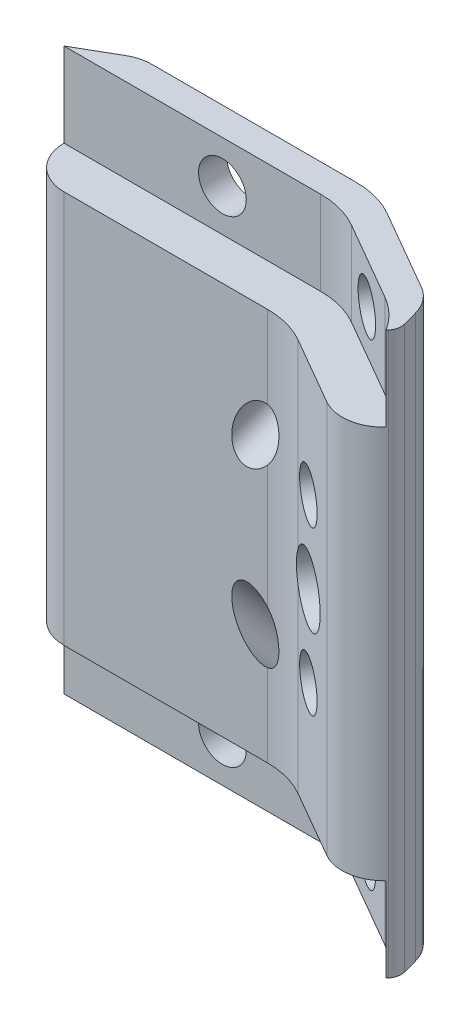
from build123d import *

# Parameters (mm, degrees)
AUFSATZ_LINEAR_AUSTRAGEN1_DEPTH  = 40
SCHNITT_LINEAR_AUSTRAGEN3_DEPTH  = 40
SCHNITT_LINEAR_START             = -6
SCHNITT_LINEAR_AUSTRAGEN4_DEPTH  = 6
SCHNITT_LINEAR_AUSTRAGEN5_DEPTH  = 6
VERRUNDUNG1_R                    = 3
SCHNITT_LINEAR_AUSTRAGEN6_REACH  = 45.817
SKIZZE5_R                        = 1.7
SCHNITT_LINEAR_AUSTRAGEN7_REACH  = 49.001
SKIZZE6_R                        = 1.7
SCHNITT_ROTATION_D_NN1_START     = 26.307192439
SCHNITT_ROTATION_D_NN1_OUTLINE_R = 1.5
SCHNITT_ROTATION_D_NN1_DEPTH     = 11.713572656
SCHNITT_ROTATION_D_NN2_START     = -1.977078808
SCHNITT_ROTATION_D_NN2_OUTLINE_R = 1.5
SCHNITT_ROTATION_D_NN2_DEPTH     = 11.713571611
VERRUNDUNG2_R                    = 1
SCHNITT_LINEAR_AUSTRAGEN8_DEPTH  = 2
SCHNITT_LINEAR_AUSTRAGEN9_REACH  = 45.817
SKIZZE10_R                       = 2.3
SKIZZE10_R_2                     = 1.7


# Read off the part's stored shape, not the designer's step: Schnitt-Rotation-Dünn1, Schnitt-Rotation-Dünn2
with BuildPart() as part:
    # Skizze1 → Aufsatz-Linear austragen1 (new body)
    with BuildSketch(Plane(origin=(0, 0, 0), x_dir=(1, 0, 0), z_dir=(0, 1, 0))):
        with BuildLine():
            Line((-5.759831503, 14.966295554), (13.068371728, 14.966295554))
            ThreePointArc((13.068371728, 14.966295554), (14.621285998, 14.761850511), (16.068371728, 14.162447976))
            Line((16.068371728, 14.162447976), (24.666447939, 9.198346361))
            Line((24.666447939, 9.198346361), (22.166447939, 4.868219342))
            Line((22.166447939, 4.868219342), (14.728625766, 9.162447976))
            ThreePointArc((14.728625766, 9.162447976), (13.281540036, 9.761850511), (11.728625766, 9.966295554))
            Line((11.728625766, 9.966295554), (-5.759831503, 9.966295554))
            Line((-5.759831503, 9.966295554), (-5.759831503, 14.966295554))
        make_face()
    extrude(amount=AUFSATZ_LINEAR_AUSTRAGEN1_DEPTH)

    # Skizze2 → Schnitt-Linear austragen3 (cut)
    with BuildSketch(Plane(origin=(0, 40, 0), x_dir=(1, 0, 0), z_dir=(0, 1, 0))):
        Polygon((-5.759831503, 14.966295554), (-5.759831503, 12.966295554), (-2.295729887, 14.966295554), align=None)
        Polygon((24.666447939, 9.198346361), (22.934397132, 10.198346361), (23.666447939, 7.466295554), align=None)
    extrude(amount=-SCHNITT_LINEAR_AUSTRAGEN3_DEPTH, mode=Mode.SUBTRACT)

    # Skizze3 → Schnitt-Linear austragen4 (cut)
    with BuildSketch(Plane(origin=(0, 40, 0), x_dir=(1, 0, 0), z_dir=(0, 1, 0)).offset(SCHNITT_LINEAR_START)):
        with BuildLine():
            Line((-5.759831503, 12.966295554), (12.532473343, 12.966295554))
            ThreePointArc((12.532473343, 12.966295554), (14.085387613, 12.761850511), (15.532473343, 12.162447976))
            Line((15.532473343, 12.162447976), (21.181781368, 8.900818467))
            ThreePointArc((21.181781368, 8.900818467), (23.993765179, 5.194915748), (23.31194468, 0.593167307))
            Line((23.31194468, 0.593167307), (22.166447939, 4.868219342))
            Line((22.166447939, 4.868219342), (14.728625766, 9.162447976))
            ThreePointArc((14.728625766, 9.162447976), (13.281540036, 9.761850511), (11.728625766, 9.966295554))
            Line((11.728625766, 9.966295554), (-5.759831503, 9.966295554))
            Line((-5.759831503, 9.966295554), (-5.759831503, 12.966295554))
        make_face()
    extrude(amount=SCHNITT_LINEAR_AUSTRAGEN4_DEPTH, mode=Mode.SUBTRACT)

    # Skizze4 → Schnitt-Linear austragen5 (cut)
    with BuildSketch(Plane.XZ):
        with BuildLine():
            Line((21.181781368, -8.900818467), (15.532473343, -12.162447976))
            ThreePointArc((15.532473343, -12.162447976), (14.085387614, -12.761850511), (12.532473343, -12.966295554))
            Line((12.532473343, -12.966295554), (-5.759831503, -12.966295554))
            Line((-5.759831503, -12.966295554), (-5.759831503, -9.966295554))
            Line((-5.759831503, -9.966295554), (11.728625766, -9.966295554))
            ThreePointArc((11.728625766, -9.966295554), (13.281540036, -9.761850511), (14.728625766, -9.162447976))
            Line((14.728625766, -9.162447976), (22.166447939, -4.868219342))
            Line((22.166447939, -4.868219342), (23.31194468, -0.593167307))
            ThreePointArc((23.31194468, -0.593167307), (23.993765179, -5.194915748), (21.181781368, -8.900818467))
        make_face()
    extrude(amount=-SCHNITT_LINEAR_AUSTRAGEN5_DEPTH, mode=Mode.SUBTRACT)

    # Verrundung1
    verrundung1_edges = [part.edges().sort_by_distance(p)[0] for p in [
        (22.934397132, 20, -10.198346361),
        (-2.295729887, 20, -14.966295554),
        (22.166447939, 20, -4.868219342),
        (-5.759831503, 20, -9.966295554),
    ]]
    fillet(verrundung1_edges, radius=VERRUNDUNG1_R - 0.0001)  # a hair under: the kernel refuses the full size

    # Skizze5 → Schnitt-Linear austragen6 (cut, up to next)
    with BuildSketch(Plane(origin=(9.149612796, 0, -15.847594231), x_dir=(0.8660254037844386, 0, 0.5000000000000003), z_dir=(-0.5000000000000002, 0, 0.8660254037844385)), mode=Mode.PRIVATE) as schnitt_linear_austragen6_sk1:
        with Locations((10.37029251, 3)):
            Circle(SKIZZE5_R)
    schnitt_linear_austragen6_tool1 = extrude(schnitt_linear_austragen6_sk1.sketch, amount=-SCHNITT_LINEAR_AUSTRAGEN6_REACH, mode=Mode.PRIVATE) & part.part
    # Skizze5 → Schnitt-Linear austragen6 (cut, up to next)
    with BuildSketch(Plane(origin=(9.149612796, 0, -15.847594231), x_dir=(0.8660254037844386, 0, 0.5000000000000003), z_dir=(-0.5000000000000002, 0, 0.8660254037844385)), mode=Mode.PRIVATE) as schnitt_linear_austragen6_sk2:
        with Locations((10.37029251, 37)):
            Circle(SKIZZE5_R)
    schnitt_linear_austragen6_tool2 = extrude(schnitt_linear_austragen6_sk2.sketch, amount=-SCHNITT_LINEAR_AUSTRAGEN6_REACH, mode=Mode.PRIVATE) & part.part
    add(schnitt_linear_austragen6_tool1.solids().sort_by_distance((18.13055, 3, -10.662448))[0], mode=Mode.SUBTRACT)
    add(schnitt_linear_austragen6_tool2.solids().sort_by_distance((18.13055, 37, -10.662448))[0], mode=Mode.SUBTRACT)

    # Skizze6 → Schnitt-Linear austragen7 (cut, up to next)
    with BuildSketch(Plane.XY.offset(-12.966295554), mode=Mode.PRIVATE) as schnitt_linear_austragen7_sk1:
        with Locations((5.532473343, 3)):
            Circle(SKIZZE6_R)
    schnitt_linear_austragen7_tool1 = extrude(schnitt_linear_austragen7_sk1.sketch, amount=-SCHNITT_LINEAR_AUSTRAGEN7_REACH, mode=Mode.PRIVATE) & part.part
    # Skizze6 → Schnitt-Linear austragen7 (cut, up to next)
    with BuildSketch(Plane.XY.offset(-12.966295554), mode=Mode.PRIVATE) as schnitt_linear_austragen7_sk2:
        with Locations((5.532473343, 37)):
            Circle(SKIZZE6_R)
    schnitt_linear_austragen7_tool2 = extrude(schnitt_linear_austragen7_sk2.sketch, amount=-SCHNITT_LINEAR_AUSTRAGEN7_REACH, mode=Mode.PRIVATE) & part.part
    add(schnitt_linear_austragen7_tool1.solids().sort_by_distance((5.532473, 3, -12.966296))[0], mode=Mode.SUBTRACT)
    add(schnitt_linear_austragen7_tool2.solids().sort_by_distance((5.532473, 37, -12.966296))[0], mode=Mode.SUBTRACT)

    # Schnitt-Rotation-Dünn1 outline → Schnitt-Rotation-Dünn1 (cut)
    with BuildSketch(Plane(origin=(0, 0, 0), x_dir=(0.9354143466934868, -0.26726124191241973, 0.23145502494313744), z_dir=(0.35355339059326996, 0.7071067811865439, -0.6123724356958009)).offset(SCHNITT_ROTATION_D_NN1_START)):
        with Locations((1.011284538, -9.386188067)):
            Circle(SCHNITT_ROTATION_D_NN1_OUTLINE_R)
    extrude(amount=SCHNITT_ROTATION_D_NN1_DEPTH, mode=Mode.SUBTRACT)

    # Schnitt-Rotation-Dünn2 outline → Schnitt-Rotation-Dünn2 (cut)
    with BuildSketch(Plane(origin=(0, 0, 0), x_dir=(0.9354143466934868, 0.26726124191241973, 0.23145502494313744), z_dir=(0.35355339059326996, -0.7071067811865439, -0.6123724356958009)).offset(SCHNITT_ROTATION_D_NN2_START)):
        with Locations((11.701734215, -16.799958762)):
            Circle(SCHNITT_ROTATION_D_NN2_OUTLINE_R)
    extrude(amount=SCHNITT_ROTATION_D_NN2_DEPTH, mode=Mode.SUBTRACT)

    # Verrundung2
    verrundung2_edges = [part.edges().sort_by_distance(p)[0] for p in [
        (23.666447939, 20, -7.466295554),
    ]]
    fillet(verrundung2_edges, radius=VERRUNDUNG2_R)

    # Skizze9 → Schnitt-Linear austragen8 (cut)
    with BuildSketch(Plane(origin=(10.149612796, 0, -17.579645039), x_dir=(-0.8660254037844383, 0, -0.5000000000000007), z_dir=(0.5000000000000007, 0, -0.8660254037844383))):
        Polygon((-7.177175397, 26.192388155), (-7.177175397, 13.807611845), (-8.984787242, 12), (-11.369563553, 12), (-13.177175397, 13.807611845), (-13.177175397, 26.192388155), (-11.369563553, 28), (-8.984787242, 28), align=None)
    extrude(amount=-SCHNITT_LINEAR_AUSTRAGEN8_DEPTH, mode=Mode.SUBTRACT)

    # Skizze10 → Schnitt-Linear austragen9 (cut, up to next)
    with BuildSketch(Plane(origin=(9.149612796, 0, -15.847594231), x_dir=(-0.8660254037844384, 0, -0.5000000000000007), z_dir=(0.5000000000000007, 0, -0.8660254037844384)), mode=Mode.PRIVATE) as schnitt_linear_austragen9_sk1:
        with Locations((-10.177175397, 20)):
            Circle(SKIZZE10_R)
    schnitt_linear_austragen9_tool1 = extrude(schnitt_linear_austragen9_sk1.sketch, amount=-SCHNITT_LINEAR_AUSTRAGEN9_REACH, mode=Mode.PRIVATE) & part.part
    # Skizze10 → Schnitt-Linear austragen9 (cut, up to next)
    with BuildSketch(Plane(origin=(9.149612796, 0, -15.847594231), x_dir=(-0.8660254037844384, 0, -0.5000000000000007), z_dir=(0.5000000000000007, 0, -0.8660254037844384)), mode=Mode.PRIVATE) as schnitt_linear_austragen9_sk2:
        with Locations((-10.177175397, 25.8)):
            Circle(SKIZZE10_R_2)
    schnitt_linear_austragen9_tool2 = extrude(schnitt_linear_austragen9_sk2.sketch, amount=-SCHNITT_LINEAR_AUSTRAGEN9_REACH, mode=Mode.PRIVATE) & part.part
    # Skizze10 → Schnitt-Linear austragen9 (cut, up to next)
    with BuildSketch(Plane(origin=(9.149612796, 0, -15.847594231), x_dir=(-0.8660254037844384, 0, -0.5000000000000007), z_dir=(0.5000000000000007, 0, -0.8660254037844384)), mode=Mode.PRIVATE) as schnitt_linear_austragen9_sk3:
        with Locations((-10.177175397, 14.2)):
            Circle(SKIZZE10_R_2)
    schnitt_linear_austragen9_tool3 = extrude(schnitt_linear_austragen9_sk3.sketch, amount=-SCHNITT_LINEAR_AUSTRAGEN9_REACH, mode=Mode.PRIVATE) & part.part
    add(schnitt_linear_austragen9_tool1.solids().sort_by_distance((17.963305, 20, -10.759007))[0], mode=Mode.SUBTRACT)
    add(schnitt_linear_austragen9_tool2.solids().sort_by_distance((17.963305, 25.8, -10.759007))[0], mode=Mode.SUBTRACT)
    add(schnitt_linear_austragen9_tool3.solids().sort_by_distance((17.963305, 14.2, -10.759007))[0], mode=Mode.SUBTRACT)


solid = part.part
